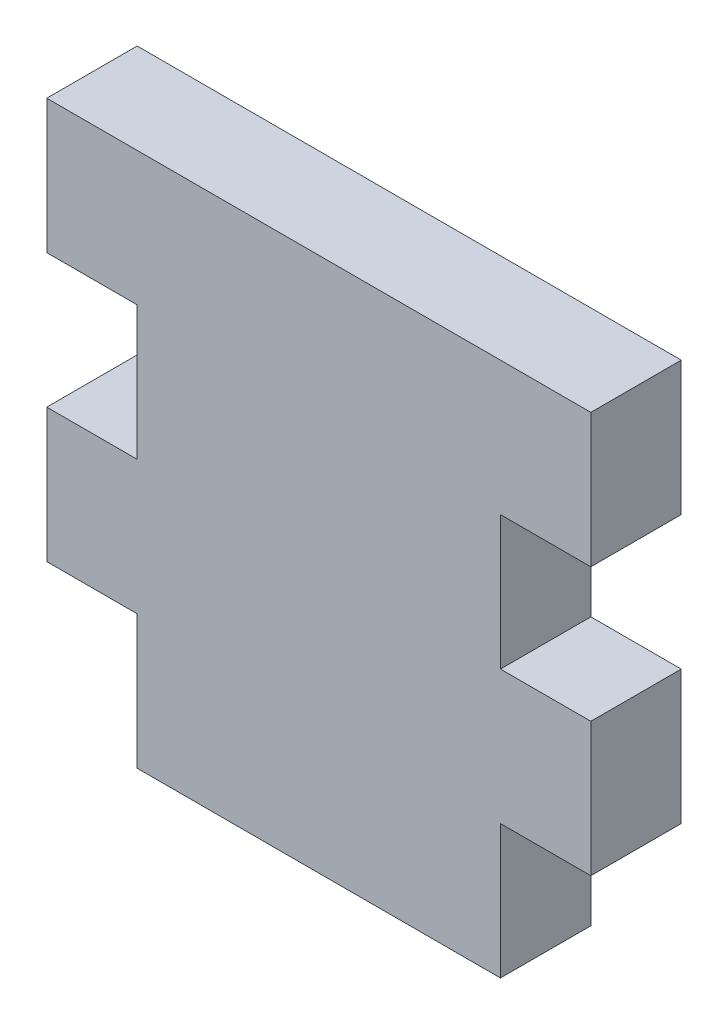
from build123d import *

# Parameters (mm, degrees)
SKETCH1_W           = 49.0728
SKETCH1_H           = 48.26
BOSS_EXTRUDE1_DEPTH = 8.1534
SKETCH2_W           = 8.1534
SKETCH2_H           = 12.065
CUT_EXTRUDE1_DEPTH  = 95.824327221


with BuildPart() as part:
    # Sketch1 → Boss-Extrude1 (new body)
    with BuildSketch(Plane.XY):
        with Locations((-63.548849325, -10.019142782)):
            Rectangle(SKETCH1_W, SKETCH1_H)
    extrude(amount=BOSS_EXTRUDE1_DEPTH)

    # Sketch2 → Cut-Extrude1 (cut, through all)
    with BuildSketch(Plane.XY.offset(8.1534)):
        with Locations((-84.008549325, -28.116642782)):
            Rectangle(SKETCH2_W, SKETCH2_H)
        with Locations((-84.008549325, -3.986642782)):
            Rectangle(SKETCH2_W, SKETCH2_H)
        with Locations((-43.089149325, -3.986642782)):
            Rectangle(SKETCH2_W, SKETCH2_H)
        with Locations((-43.089149325, -28.116642782)):
            Rectangle(SKETCH2_W, SKETCH2_H)
    extrude(amount=-CUT_EXTRUDE1_DEPTH, mode=Mode.SUBTRACT)


solid = part.part
